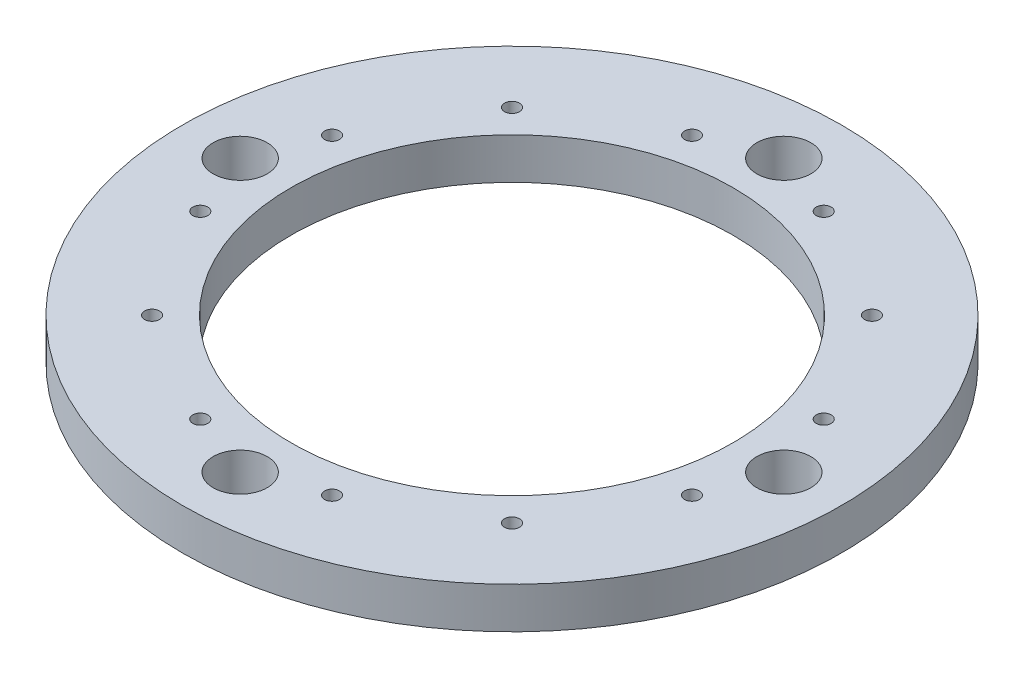
from build123d import *

# Parameters (mm, degrees)
CENTERING_RING_PROFILE_R    = 76.2
CENTERING_RING_PROFILE_R_2  = 51.1048
CENTERING_RING_BODY_DEPTH   = 9.525
MOTOR_MOUNT_HOLE_PROFILE_R  = 1.7272
MOTOR_MOUNT_HOLE_CUTS_DEPTH = 109.183203987
VENT_HOLE_PROFILE_R         = 6.249999946
VENT_HOLE_CUTS_DEPTH        = 109.183203987


with BuildPart() as part:
    # Centering Ring Profile → Centering Ring Body (new body)
    with BuildSketch(Plane(origin=(0, 0, 0), x_dir=(1, 0, 0), z_dir=(0, 1, 0))):
        Circle(CENTERING_RING_PROFILE_R)
        Circle(CENTERING_RING_PROFILE_R_2, mode=Mode.SUBTRACT)
    extrude(amount=CENTERING_RING_BODY_DEPTH)

    # Motor Mount Hole Profile → Motor Mount Hole Cuts (cut, through all)
    with BuildSketch(Plane(origin=(0, 9.525, 0), x_dir=(1, 0, 0), z_dir=(0, 1, 0))):
        with Locations((-15.231500779, 56.844734782)):
            Circle(MOTOR_MOUNT_HOLE_PROFILE_R)
        with Locations((15.231500779, 56.844734782)):
            Circle(MOTOR_MOUNT_HOLE_PROFILE_R)
        with Locations((41.613234004, 41.613234004)):
            Circle(MOTOR_MOUNT_HOLE_PROFILE_R)
        with Locations((56.844734782, 15.231500779)):
            Circle(MOTOR_MOUNT_HOLE_PROFILE_R)
        with Locations((56.844734782, -15.231500779)):
            Circle(MOTOR_MOUNT_HOLE_PROFILE_R)
        with Locations((41.613234004, -41.613234004)):
            Circle(MOTOR_MOUNT_HOLE_PROFILE_R)
        with Locations((15.231500779, -56.844734782)):
            Circle(MOTOR_MOUNT_HOLE_PROFILE_R)
        with Locations((-15.231500779, -56.844734782)):
            Circle(MOTOR_MOUNT_HOLE_PROFILE_R)
        with Locations((-41.613234004, -41.613234004)):
            Circle(MOTOR_MOUNT_HOLE_PROFILE_R)
        with Locations((-56.844734782, -15.231500779)):
            Circle(MOTOR_MOUNT_HOLE_PROFILE_R)
        with Locations((-56.844734782, 15.231500779)):
            Circle(MOTOR_MOUNT_HOLE_PROFILE_R)
        with Locations((-41.613234004, 41.613234004)):
            Circle(MOTOR_MOUNT_HOLE_PROFILE_R)
    extrude(amount=-MOTOR_MOUNT_HOLE_CUTS_DEPTH, mode=Mode.SUBTRACT)

    # Vent Hole Profile → Vent Hole Cuts (cut, through all)
    with BuildSketch(Plane(origin=(0, 9.525, 0), x_dir=(1, 0, 0), z_dir=(0, 1, 0))):
        with Locations((-62.85000003, 0)):
            Circle(VENT_HOLE_PROFILE_R)
        with Locations((0, 62.85000003)):
            Circle(VENT_HOLE_PROFILE_R)
        with Locations((62.85000003, 0)):
            Circle(VENT_HOLE_PROFILE_R)
        with Locations((0, -62.85000003)):
            Circle(VENT_HOLE_PROFILE_R)
    extrude(amount=-VENT_HOLE_CUTS_DEPTH, mode=Mode.SUBTRACT)


solid = part.part
